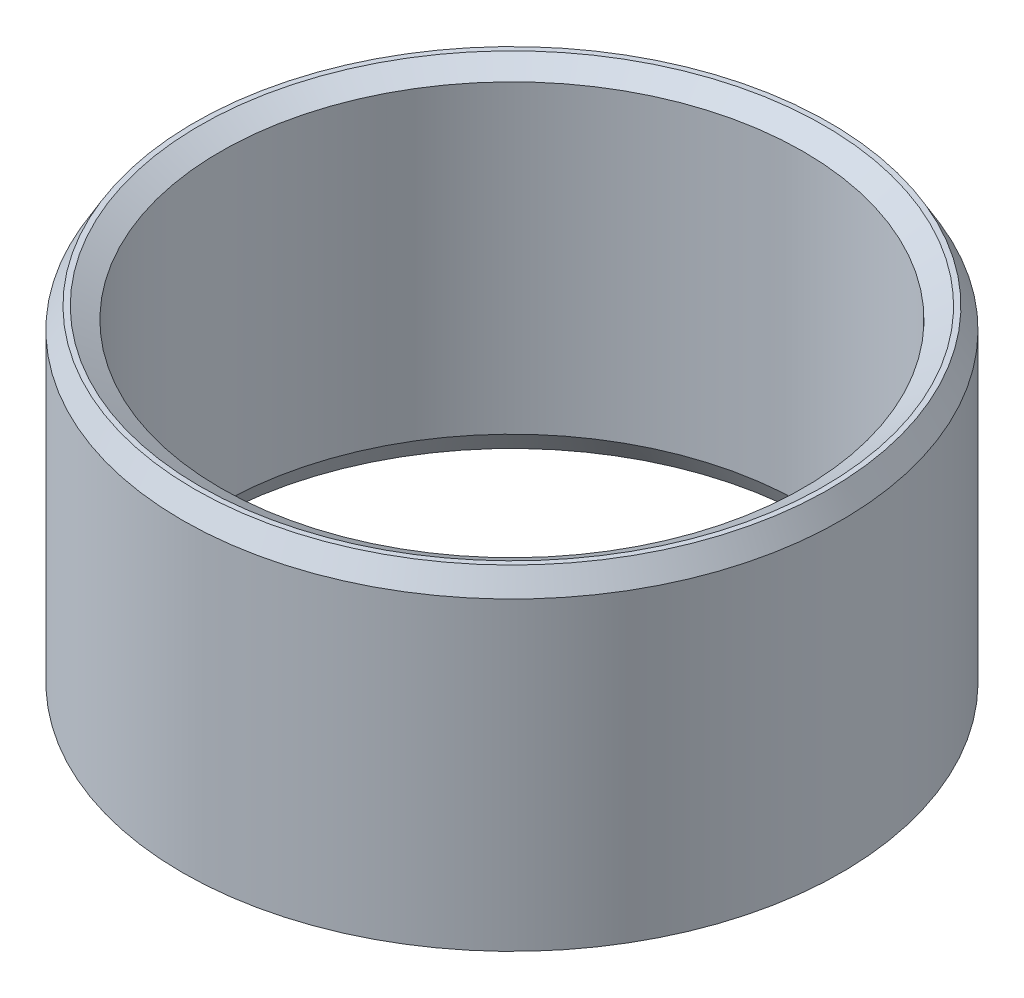
from build123d import *
from OCP.BRepFilletAPI import BRepFilletAPI_MakeChamfer

# Parameters (mm, degrees)
SKETCH1_R           = 37.5
BOSS_EXTRUDE1_DEPTH = 38.473463333
SKETCH2_R           = 33.155892158
CUT_EXTRUDE1_DEPTH  = 66.518755947
CHAMFER1_SIZE       = 2.379923537
CHAMFER1_SIZE2      = 1.374049495


with BuildPart() as part:
    # Sketch1 → Boss-Extrude1 (new body)
    with BuildSketch(Plane(origin=(0, 0, 0), x_dir=(1, 0, 0), z_dir=(0, 1, 0))):
        Circle(SKETCH1_R)
    extrude(amount=BOSS_EXTRUDE1_DEPTH)

    # Sketch2 → Cut-Extrude1 (cut, through all)
    with BuildSketch(Plane(origin=(0, 0, 0), x_dir=(1, 0, 0), z_dir=(0, 1, 0))):
        Circle(SKETCH2_R)
    extrude(amount=CUT_EXTRUDE1_DEPTH, mode=Mode.SUBTRACT)

    # Chamfer1: one chamfer whose edges measure the first distance from different faces: ONE call of the kernel's chamfer builder (chamfer() names one face for all edges)
    chamfer1_edges_1 = [part.edges().sort_by_distance(p)[0] for p in [
        (-33.155892158, 38.473463333, 0),
    ]]
    chamfer1_side_1 = [part.faces().sort_by_distance(p)[0] for p in [
        (-36.439339828, 38.473463333, 0),
    ]]
    chamfer1_edges_2 = [part.edges().sort_by_distance(p)[0] for p in [
        (-33.155892158, 0, 0),
    ]]
    chamfer1_side_2 = [part.faces().sort_by_distance(p)[0] for p in [
        (-33.155892158, 19.236731666, 0),
    ]]
    chamfer1_edges_3 = [part.edges().sort_by_distance(p)[0] for p in [
        (-37.5, 0, 0),
    ]]
    chamfer1_side_3 = [part.faces().sort_by_distance(p)[0] for p in [
        (-36.439339828, 0, 0),
    ]]
    chamfer1_edges_4 = [part.edges().sort_by_distance(p)[0] for p in [
        (-37.5, 38.473463333, 0),
    ]]
    chamfer1_side_4 = [part.faces().sort_by_distance(p)[0] for p in [
        (-37.5, 19.236731666, 0),
    ]]
    chamfer1 = BRepFilletAPI_MakeChamfer(part.part.solid().wrapped)
    for e in chamfer1_edges_1:
        chamfer1.Add(CHAMFER1_SIZE, CHAMFER1_SIZE2, e.wrapped, chamfer1_side_1[0].wrapped)  # the first distance lies on this face
    for e in chamfer1_edges_2:
        chamfer1.Add(CHAMFER1_SIZE, CHAMFER1_SIZE2, e.wrapped, chamfer1_side_2[0].wrapped)  # the first distance lies on this face
    for e in chamfer1_edges_3:
        chamfer1.Add(CHAMFER1_SIZE, CHAMFER1_SIZE2, e.wrapped, chamfer1_side_3[0].wrapped)  # the first distance lies on this face
    for e in chamfer1_edges_4:
        chamfer1.Add(CHAMFER1_SIZE, CHAMFER1_SIZE2, e.wrapped, chamfer1_side_4[0].wrapped)  # the first distance lies on this face
    add(Compound.cast(chamfer1.Shape()), mode=Mode.REPLACE)


solid = part.part
